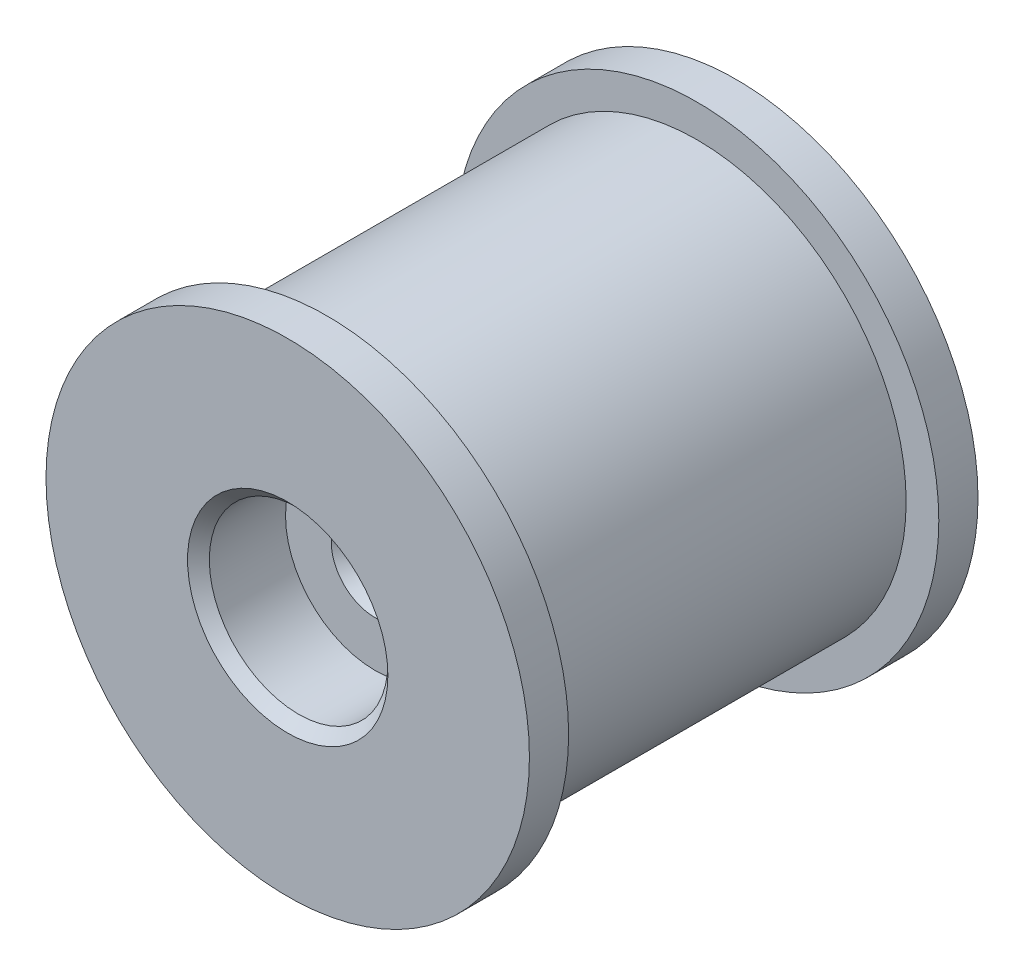
from build123d import *

# Parameters (mm, degrees)
AUFSATZ_LINEAR_AUSTRAGEN1_DEPTH      = 10.3
AUFSATZ_LINEAR_AUSTRAGEN1_DEPTH_BACK = 10.3
SKIZZE1_R                            = 9.6
SKIZZE2_R                            = 11.1
AUFSATZ_LINEAR_AUSTRAGEN2_DEPTH      = 1.8
AUFSATZ_LINEAR_START                 = -1.8
SKIZZE3_R                            = 11.1
AUFSATZ_LINEAR_AUSTRAGEN3_DEPTH      = 1.8
FASE1_SIZE                           = 0.5


with BuildPart() as part:
    # Skizze1 → Aufsatz-Linear austragen1 (new, two sides: drawn at the far end of the back side and taken through both)
    with BuildSketch(Plane.XY.offset(-AUFSATZ_LINEAR_AUSTRAGEN1_DEPTH_BACK)):
        Circle(SKIZZE1_R)
    extrude(amount=AUFSATZ_LINEAR_AUSTRAGEN1_DEPTH + AUFSATZ_LINEAR_AUSTRAGEN1_DEPTH_BACK)

    # Skizze2 → Aufsatz-Linear austragen2 (add)
    with BuildSketch(Plane.XY.offset(10.3)):
        Circle(SKIZZE2_R)
    extrude(amount=-AUFSATZ_LINEAR_AUSTRAGEN2_DEPTH)

    # Skizze3 → Aufsatz-Linear austragen3 (add)
    with BuildSketch(Plane(origin=(0, 0, -10.3), x_dir=(-1, 0, 0), z_dir=(0, 0, -1)).offset(AUFSATZ_LINEAR_START)):
        Circle(SKIZZE3_R)
    extrude(amount=AUFSATZ_LINEAR_AUSTRAGEN3_DEPTH)

    # Skizze8 → Schnitt-Rotation1 (revolve, cut)
    with BuildSketch(Plane(origin=(0, 0, 0), x_dir=(0, 0, -1), z_dir=(1, 0, 0))):
        Polygon((10.3, 0), (10.3, 8), (8.5, 8), (-3.7, 4), (-3.7, 1.5), (-6.3, 1.5), (-6.3, 4.1), (-10.3, 4.1), (-10.3, 0), align=None)
    revolve(axis=Axis((0, 0, -9.8), (0, 0, 1)), mode=Mode.SUBTRACT)

    # Fase1
    fase1_edges = [part.edges().sort_by_distance(p)[0] for p in [
        (0, -1.5, 6.3),
        (0, -1.5, 3.7),
        (0, -4.1, 10.3),
    ]]
    chamfer(fase1_edges, length=FASE1_SIZE)


solid = part.part
